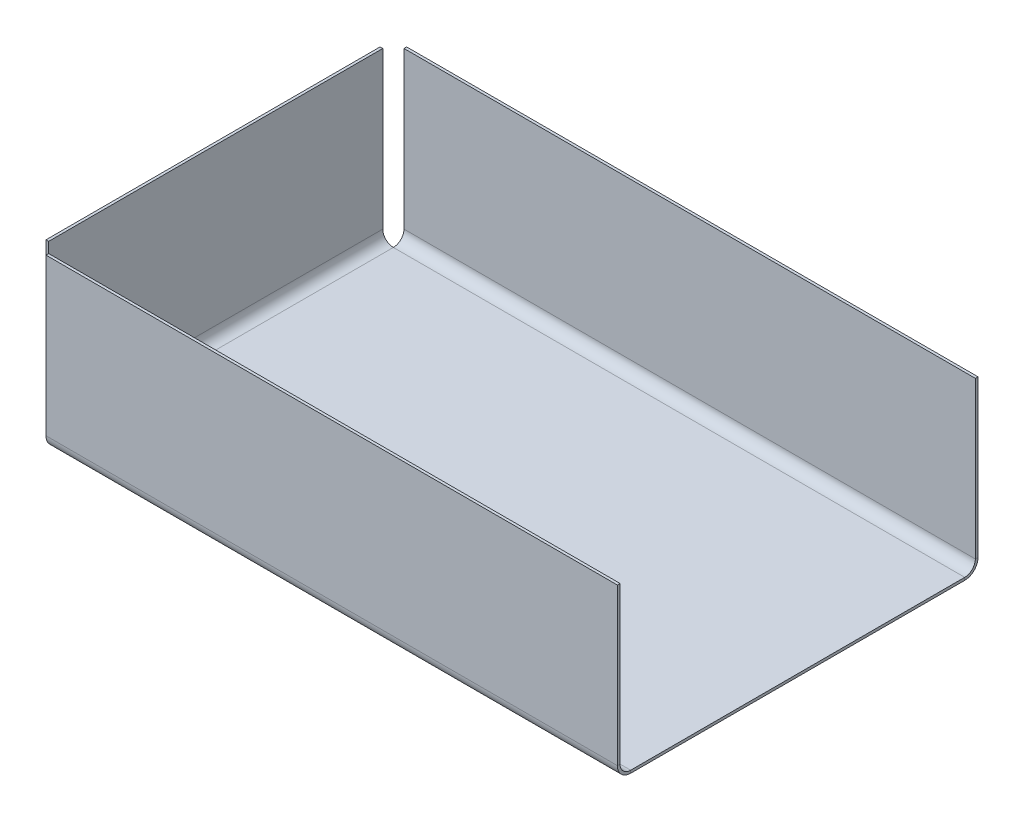
from build123d import *

# Parameters (mm, degrees)
SKETCH1_W                    = 350
SKETCH1_H                    = 200
BASE_FLANGE1_DEPTH           = 1.6002
EDGE_FLANGE4_STRIP_W         = 19.1008
EDGE_FLANGE4_STRIP_H         = 1.6002
EDGE_FLANGE4_STRIP_CUT_DEPTH = 200
EDGE_FLANGE4_DEPTH           = 200
EDGE_FLANGE5_DEPTH           = 342.0498
EDGE_FLANGE5_BEND_DEPTH      = 342.0498


# Sheet-metal steps are written as plain solids
with BuildPart() as part:
    # Sketch1 → Base-Flange1 (new body)
    with BuildSketch(Plane(origin=(0, 0, 0), x_dir=(1, 0, 0), z_dir=(0, 1, 0))):
        Rectangle(SKETCH1_W, SKETCH1_H)
    extrude(amount=-BASE_FLANGE1_DEPTH)

    # Edge-Flange4 strip (across the edge) → Edge-Flange4 strip cut (cut)
    with BuildSketch(Plane(origin=(-175, 0, -100), x_dir=(1, 0, 0), z_dir=(0, 0, 1))):
        with Locations((-1.6002, -0.8001)):
            Rectangle(EDGE_FLANGE4_STRIP_W, EDGE_FLANGE4_STRIP_H)
    extrude(amount=EDGE_FLANGE4_STRIP_CUT_DEPTH, mode=Mode.SUBTRACT)

    # Edge-Flange4 section (across the edge) → Edge-Flange4 (add)
    with BuildSketch(Plane(origin=(-175, 0, -100), x_dir=(1, 0, 0), z_dir=(0, 0, 1))):
        with BuildLine():
            Line((0, 6.35), (0, 100))
            Line((0, 100), (1.6002, 100))
            Line((1.6002, 100), (1.6002, 6.35))
            ThreePointArc((1.6002, 6.35), (3.460071939, 1.859871939), (7.9502, 0))
            Line((7.9502, 0), (7.9502, -1.6002))
            ThreePointArc((7.9502, -1.6002), (2.328559668, 0.728359668), (0, 6.35))
        make_face()
    extrude(amount=EDGE_FLANGE4_DEPTH)

    # Edge-Flange5 section (across the edge) → Edge-Flange5 (add)
    with BuildSketch(Plane(origin=(-167.0498, 0, 106.35), x_dir=(0, 0, -1), z_dir=(1, 0, 0))):
        with BuildLine():
            Line((-1.6002, 6.35), (-1.6002, 100))
            Line((-1.6002, 100), (0, 100))
            Line((0, 100), (0, 6.35))
            ThreePointArc((0, 6.35), (1.859871939, 1.859871939), (6.35, 0))
            Line((6.35, 0), (6.35, -1.6002))
            ThreePointArc((6.35, -1.6002), (0.728359668, 0.728359668), (-1.6002, 6.35))
        make_face()
    extrude(amount=EDGE_FLANGE5_DEPTH)

    # Edge-Flange5 section 2 (across the edge) → Edge-Flange5 bend (add)
    with BuildSketch(Plane(origin=(175, 0, -106.35), x_dir=(0, 0, 1), z_dir=(-1, 0, 0))):
        with BuildLine():
            Line((-1.6002, 6.35), (-1.6002, 100))
            Line((-1.6002, 100), (0, 100))
            Line((0, 100), (0, 6.35))
            ThreePointArc((0, 6.35), (1.859871939, 1.859871939), (6.35, 0))
            Line((6.35, 0), (6.35, -1.6002))
            ThreePointArc((6.35, -1.6002), (0.728359668, 0.728359668), (-1.6002, 6.35))
        make_face()
    extrude(amount=EDGE_FLANGE5_BEND_DEPTH)


solid = part.part
